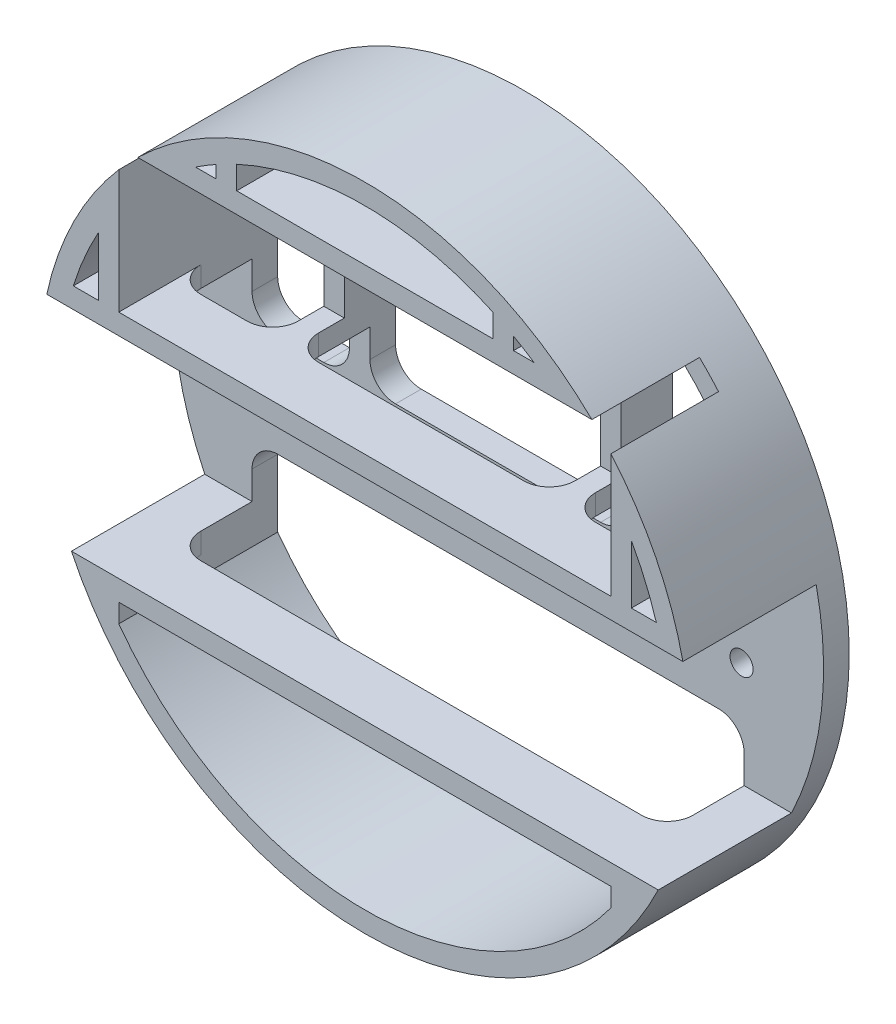
from build123d import *
from build123d.topology import SkipClean

# Parameters (mm, degrees)
BOSS_EXTRUDE1_DEPTH = 31
BOSS_EXTRUDE3_DEPTH = 10
BOSS_EXTRUDE4_DEPTH = 5
SKETCH6_W           = 19
SKETCH6_H           = 10.5
SKETCH6_R           = 2.25
SKETCH6_W_2         = 50
SKETCH6_W_3         = 96
CUT_EXTRUDE1_DEPTH  = 94.490641243
CUT_EXTRUDE2_DEPTH  = 10
SKETCH9_W           = 96
SKETCH9_H           = 4
SKETCH9_W_2         = 19
SKETCH9_W_3         = 50
CUT_EXTRUDE4_DEPTH  = 20
BOSS_EXTRUDE5_DEPTH = 31
FILLET3_R           = 5


with BuildPart() as part:
    # Sketch1 → Boss-Extrude1 (new body)
    with BuildSketch(Plane.XY):
        with BuildLine():
            ThreePointArc((-50.477717856, -31.5), (-51.659400485, -29.522133079), (-52.763623833, -27.5))
            Line((-52.763623833, -27.5), (-57.236352085, -27.5))
            ThreePointArc((-57.236352085, -27.5), (0, -63.5), (57.236352085, -27.5))
            Line((57.236352085, -27.5), (52.763623833, -27.5))
            ThreePointArc((52.763623833, -27.5), (51.659400485, -29.522133079), (50.477717856, -31.5))
            ThreePointArc((50.477717856, -31.5), (49.272860314, -33.353189299), (48, -35.160346983))
            ThreePointArc((48, -35.160346983), (0, -59.5), (-48, -35.160346983))
            ThreePointArc((-48, -35.160346983), (-49.272860314, -33.353189299), (-50.477717856, -31.5))
        make_face()
        with BuildLine():
            Line((52.763623833, -27.5), (-52.763623833, -27.5))
            ThreePointArc((-52.763623833, -27.5), (-51.659400485, -29.522133079), (-50.477717856, -31.5))
            Line((-50.477717856, -31.5), (-48, -31.5))
            Line((-48, -31.5), (48, -31.5))
            Line((48, -31.5), (50.477717856, -31.5))
            ThreePointArc((50.477717856, -31.5), (51.659400485, -29.522133079), (52.763623833, -27.5))
        make_face()
        with BuildLine():
            ThreePointArc((-56.868268832, 17.5), (-57.443088433, 15.50940332), (-57.948252778, 13.5))
            Line((-57.948252778, 13.5), (57.948252778, 13.5))
            ThreePointArc((57.948252778, 13.5), (57.443088433, 15.50940332), (56.868268832, 17.5))
            Line((56.868268832, 17.5), (52, 17.5))
            Line((52, 17.5), (48, 17.5))
            Line((48, 17.5), (-48, 17.5))
            Line((-48, 17.5), (-52, 17.5))
            Line((-52, 17.5), (-56.868268832, 17.5))
        make_face()
        with BuildLine():
            Line((-52, 28.917987482), (-52, 17.5))
            Line((-52, 17.5), (-48, 17.5))
            Line((-48, 17.5), (-48, 35.160346983))
            ThreePointArc((-48, 35.160346983), (-50.097322913, 32.101530134), (-52, 28.917987482))
        make_face()
        with BuildLine():
            Line((-62.04836823, 13.5), (-57.948252778, 13.5))
            ThreePointArc((-57.948252778, 13.5), (-57.443088433, 15.50940332), (-56.868268832, 17.5))
            ThreePointArc((-56.868268832, 17.5), (-54.732692234, 23.336289354), (-52, 28.917987482))
            ThreePointArc((-52, 28.917987482), (-50.097322913, 32.101530134), (-48, 35.160346983))
            Line((-48, 35.160346983), (-48, 41.572226306))
            ThreePointArc((-48, 41.572226306), (-56.78620704, 28.417893835), (-62.04836823, 13.5))
        make_face()
        with BuildLine():
            ThreePointArc((56.868268832, 17.5), (57.443088433, 15.50940332), (57.948252778, 13.5))
            Line((57.948252778, 13.5), (62.04836823, 13.5))
            ThreePointArc((62.04836823, 13.5), (56.78620704, 28.417893835), (48, 41.572226306))
            Line((48, 41.572226306), (48, 35.160346983))
            ThreePointArc((48, 35.160346983), (50.097322913, 32.101530134), (52, 28.917987482))
            ThreePointArc((52, 28.917987482), (54.732692234, 23.336289354), (56.868268832, 17.5))
        make_face()
        with BuildLine():
            Line((48, 17.5), (52, 17.5))
            Line((52, 17.5), (52, 28.917987482))
            ThreePointArc((52, 28.917987482), (50.097322913, 32.101530134), (48, 35.160346983))
            Line((48, 35.160346983), (48, 17.5))
        make_face()
        with BuildLine():
            ThreePointArc((44.294469181, 45.5), (0, 63.5), (-44.294469181, 45.5))
            Line((-44.294469181, 45.5), (-38.340579025, 45.5))
            ThreePointArc((-38.340579025, 45.5), (-35.733876731, 47.574573606), (-33.015148038, 49.5))
            ThreePointArc((-33.015148038, 49.5), (0, 59.5), (33.015148038, 49.5))
            ThreePointArc((33.015148038, 49.5), (35.733876731, 47.574573606), (38.340579025, 45.5))
            Line((38.340579025, 45.5), (44.294469181, 45.5))
        make_face()
        with BuildLine():
            ThreePointArc((-33.015148038, 49.5), (-35.733876731, 47.574573606), (-38.340579025, 45.5))
            Line((-38.340579025, 45.5), (38.340579025, 45.5))
            ThreePointArc((38.340579025, 45.5), (35.733876731, 47.574573606), (33.015148038, 49.5))
            Line((33.015148038, 49.5), (-33.015148038, 49.5))
        make_face()
        with BuildLine():
            ThreePointArc((48, -35.160346983), (49.272860314, -33.353189299), (50.477717856, -31.5))
            Line((50.477717856, -31.5), (48, -31.5))
            Line((48, -31.5), (48, -35.160346983))
        make_face()
        with BuildLine():
            Line((-48, -31.5), (-50.477717856, -31.5))
            ThreePointArc((-50.477717856, -31.5), (-49.272860314, -33.353189299), (-48, -35.160346983))
            Line((-48, -35.160346983), (-48, -31.5))
        make_face()
    extrude(amount=BOSS_EXTRUDE1_DEPTH)

    # Sketch2 → Boss-Extrude3 (add)
    with SkipClean():  # the faces are left unmerged after this step: merging them gives an invalid solid
        with BuildSketch(Plane(origin=(0, 0, 0), x_dir=(-1, 0, 0), z_dir=(0, 0, -1))):
            with BuildLine():
                ThreePointArc((48, 41.572226306), (46.189004231, 43.575519367), (44.294469181, 45.5))
                Line((44.294469181, 45.5), (25, 45.5))
                Line((25, 45.5), (25, 17.5))
                Line((25, 17.5), (48, 17.5))
                Line((48, 17.5), (48, 41.572226306))
            make_face()
            with BuildLine():
                Line((-25, 45.5), (-44.294469181, 45.5))
                ThreePointArc((-44.294469181, 45.5), (-46.189004231, 43.575519367), (-48, 41.572226306))
                Line((-48, 41.572226306), (-48, 17.5))
                Line((-48, 17.5), (-25, 17.5))
                Line((-25, 17.5), (-25, 45.5))
            make_face()
        extrude(amount=-BOSS_EXTRUDE3_DEPTH)

    # Sketch4 → Boss-Extrude4 (add)
    with SkipClean():  # the faces are left unmerged after this step: merging them gives an invalid solid
        with BuildSketch(Plane(origin=(0, 0, 0), x_dir=(-1, 0, 0), z_dir=(0, 0, -1))):
            with BuildLine():
                Line((-57.236352085, -27.5), (57.236352085, -27.5))
                ThreePointArc((57.236352085, -27.5), (63.067116036, -7.401950746), (62.04836823, 13.5))
                Line((62.04836823, 13.5), (-62.04836823, 13.5))
                ThreePointArc((-62.04836823, 13.5), (-63.067116036, -7.401950746), (-57.236352085, -27.5))
            make_face()
        extrude(amount=-BOSS_EXTRUDE4_DEPTH)

    # Sketch6 → Cut-Extrude1 (cut, through all)
    with SkipClean():  # the faces are left unmerged after this step: merging them gives an invalid solid
        with BuildSketch(Plane.XY.offset(5)):
            with Locations((-38.5, 8.25)):
                Rectangle(SKETCH6_W, SKETCH6_H)
            with Locations((-47.5, -7)):
                Circle(SKETCH6_R)
            with Locations((0, 8.25)):
                Rectangle(SKETCH6_W_2, SKETCH6_H)
            with Locations((0, -22.25)):
                Rectangle(SKETCH6_W_3, SKETCH6_H)
            with Locations((38.5, 8.25)):
                Rectangle(SKETCH6_W, SKETCH6_H)
            with Locations((47.5, -7)):
                Circle(SKETCH6_R)
        extrude(amount=-CUT_EXTRUDE1_DEPTH, mode=Mode.SUBTRACT)

    # Sketch7 → Cut-Extrude2 (cut)
    with SkipClean():  # the faces are left unmerged after this step: merging them gives an invalid solid
        with BuildSketch(Plane(origin=(0, 0, 0), x_dir=(-1, 0, 0), z_dir=(0, 0, -1))):
            with BuildLine():
                Line((-29, 17.5), (-48, 17.5))
                Line((-48, 17.5), (-48, 35.160346983))
                ThreePointArc((-48, 35.160346983), (-43.478741964, 40.618333265), (-38.340579025, 45.5))
                Line((-38.340579025, 45.5), (-29, 45.5))
                Line((-29, 45.5), (-29, 17.5))
            make_face()
            with BuildLine():
                Line((29, 17.5), (48, 17.5))
                Line((48, 17.5), (48, 35.160346983))
                ThreePointArc((48, 35.160346983), (43.478741964, 40.618333265), (38.340579025, 45.5))
                Line((38.340579025, 45.5), (29, 45.5))
                Line((29, 45.5), (29, 17.5))
            make_face()
        extrude(amount=-CUT_EXTRUDE2_DEPTH, mode=Mode.SUBTRACT)

    # Sketch9 → Cut-Extrude4 (cut)
    with SkipClean():  # the faces are left unmerged after this step: merging them gives an invalid solid
        with BuildSketch(Plane(origin=(0, 0, 0), x_dir=(-1, 0, 0), z_dir=(0, 0, -1))):
            with Locations((0, -29.5)):
                Rectangle(SKETCH9_W, SKETCH9_H)
            with Locations((-38.5, 15.5)):
                Rectangle(SKETCH9_W_2, SKETCH9_H)
            with Locations((0, 15.5)):
                Rectangle(SKETCH9_W_3, SKETCH9_H)
            with Locations((38.5, 15.5)):
                Rectangle(SKETCH9_W_2, SKETCH9_H)
            with Locations((0, 47.5)):
                Rectangle(SKETCH9_W_3, SKETCH9_H)
        extrude(amount=-CUT_EXTRUDE4_DEPTH, mode=Mode.SUBTRACT)

    # Sketch10 → Boss-Extrude5 (add)
    with SkipClean():  # the faces are left unmerged after this step: merging them gives an invalid solid
        with BuildSketch(Plane(origin=(0, 0, 0), x_dir=(-1, 0, 0), z_dir=(0, 0, -1))):
            with BuildLine():
                Line((-29.007574019, 51.950078436), (-29.007574019, 49.5))
                Line((-29.007574019, 49.5), (-25, 49.5))
                Line((-25, 49.5), (-25, 53.993055109))
                ThreePointArc((-25, 53.993055109), (-27.023100327, 53.009452447), (-29.007574019, 51.950078436))
            make_face()
            with BuildLine():
                ThreePointArc((29.007574019, 51.950078436), (27.023100327, 53.009452447), (25, 53.993055109))
                Line((25, 53.993055109), (25, 49.5))
                Line((25, 49.5), (29.007574019, 49.5))
                Line((29.007574019, 49.5), (29.007574019, 51.950078436))
            make_face()
        extrude(amount=-BOSS_EXTRUDE5_DEPTH)

    # Fillet3
    # the kernel refuses this fillet: 5 mm, written as the material it adds along each edge
    with BuildSketch(Plane(origin=(48, -17, 5), x_dir=(-1, 0, 0), z_dir=(0, 0, -1)), Plane(origin=(-48, -17, 5), x_dir=(0, -1, 0), z_dir=(0, 0, -1)), Plane(origin=(-29, 3, 5), x_dir=(0, 1, 0), z_dir=(0, 0, -1)), Plane(origin=(25, 3, 5), x_dir=(0, 1, 0), z_dir=(0, 0, -1)), Plane(origin=(48, 3, 5), x_dir=(0, 1, 0), z_dir=(0, 0, -1))) as fillet3_piece_1:
        with BuildLine():
            CenterArc((FILLET3_R, -FILLET3_R), FILLET3_R, 90, 90)
            Line((0, -FILLET3_R), (0, 0))
            Line((0, 0), (FILLET3_R, 0))
        make_face()
    extrude(amount=5)
    with BuildSketch(Plane(origin=(-48, 3, 5), x_dir=(0, 1, 0), z_dir=(0, 0, -1)), Plane(origin=(-25, 3, 5), x_dir=(0, 1, 0), z_dir=(0, 0, -1)), Plane(origin=(29, 3, 5), x_dir=(0, 1, 0), z_dir=(0, 0, -1))) as fillet3_piece_2:
        with BuildLine():
            CenterArc((FILLET3_R, FILLET3_R), FILLET3_R, 180, 90)
            Line((0, FILLET3_R), (0, 0))
            Line((0, 0), (FILLET3_R, 0))
        make_face()
    extrude(amount=5)
    with BuildSketch(Plane(origin=(48, -31.5, 20), x_dir=(0, 0, -1), z_dir=(0, 1, 0)), Plane(origin=(25, 49.5, 20), x_dir=(-1, 0, 0), z_dir=(0, -1, 0)), Plane(origin=(-29, 13.5, 20), x_dir=(0, 0, -1), z_dir=(0, 1, 0)), Plane(origin=(-48, 17.5, 20), x_dir=(0, 0, -1), z_dir=(0, -1, 0)), Plane(origin=(25, 13.5, 20), x_dir=(0, 0, -1), z_dir=(0, 1, 0))) as fillet3_piece_3:
        with BuildLine():
            CenterArc((FILLET3_R, FILLET3_R), FILLET3_R, 180, 90)
            Line((0, FILLET3_R), (0, 0))
            Line((0, 0), (FILLET3_R, 0))
        make_face()
    extrude(amount=4)
    with BuildSketch(Plane(origin=(-48, -27.5, 20), x_dir=(1, 0, 0), z_dir=(0, -1, 0)), Plane(origin=(-25, 45.5, 20), x_dir=(0, 0, -1), z_dir=(0, 1, 0)), Plane(origin=(-25, 17.5, 20), x_dir=(1, 0, 0), z_dir=(0, -1, 0)), Plane(origin=(48, 13.5, 20), x_dir=(-1, 0, 0), z_dir=(0, 1, 0)), Plane(origin=(29, 17.5, 20), x_dir=(1, 0, 0), z_dir=(0, -1, 0))) as fillet3_piece_4:
        with BuildLine():
            CenterArc((FILLET3_R, -FILLET3_R), FILLET3_R, 90, 90)
            Line((0, -FILLET3_R), (0, 0))
            Line((0, 0), (FILLET3_R, 0))
        make_face()
    extrude(amount=4)


solid = part.part
